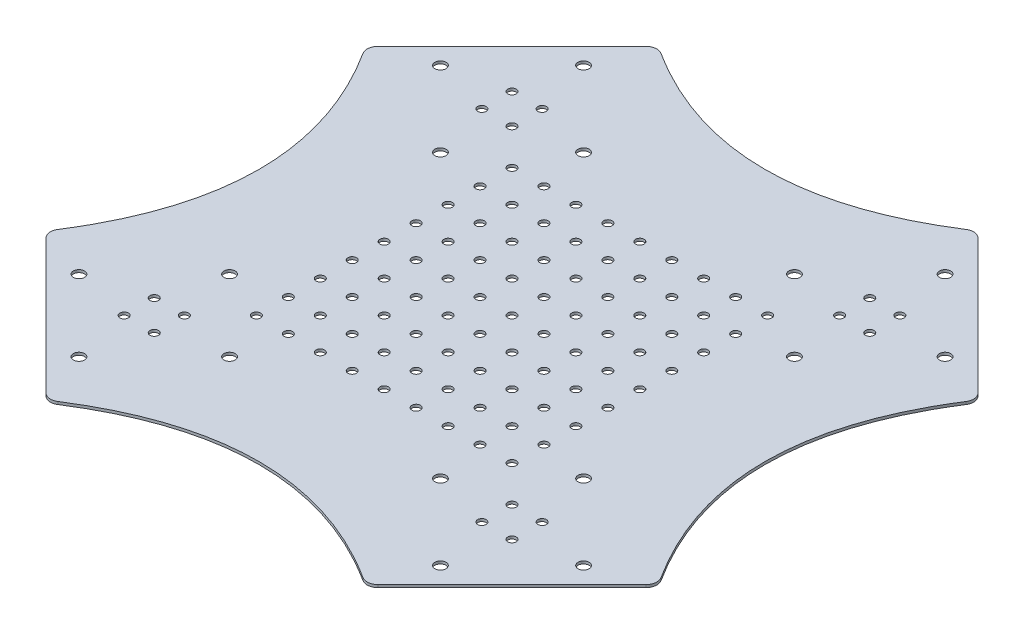
from build123d import *

# Parameters (mm, degrees)
DODANIE_WYCI_GNI_CIE1_DEPTH = 1
ZAOKR_GLENIE1_R             = 4
SZKIC2_R                    = 2.1
WYTNIJ_WYCI_GNI_CIE1_DEPTH  = 162.050129512
SZYK_KO_OWY1_COUNT          = 4
SZKIC3_R                    = 1.6
WYTNIJ_WYCI_GNI_CIE2_DEPTH  = 162.050129512
SZYK_KO_OWY2_OUTLINE_R      = 1.6
SZYK_KO_OWY2_DEPTH          = 1
WYTNIJ_WYCI_GNI_CIE3_REACH  = 163.05
SZKIC4_R                    = 1.6
SZYK_LINIOWY1_COUNT         = 5
SZYK_LINIOWY1_PITCH         = 12
SZYK_LINIOWY1_COUNT_DIR2    = 5
SZYK_LINIOWY1_PITCH_DIR2    = 12
SZYK_KO_OWY3_OUTLINE_R      = 1.6
SZYK_KO_OWY3_DEPTH          = 1


# Read off the part's stored shape, not the designer's step: Szyk kołowy2, Szyk kołowy3
with BuildPart() as part:
    # Szkic1 → Dodanie-wyciągnięcie1 (new body)
    with BuildSketch(Plane(origin=(0, 0, 0), x_dir=(1, 0, 0), z_dir=(0, 1, 0))):
        with BuildLine():
            Line((-60, -115), (-115, -60))
            add(Edge.make_bspline(
                [(-115, 60), (-75, 0), (-115, -60)],
                knots=[0, 0, 0, 1, 1, 1], degree=2))
            Line((-115, 60), (-60, 115))
            add(Edge.make_bspline(
                [(60, 115), (0, 75), (-60, 115)],
                knots=[0, 0, 0, 1, 1, 1], degree=2))
            Line((60, 115), (115, 60))
            add(Edge.make_bspline(
                [(115, -60), (75, 0), (115, 60)],
                knots=[0, 0, 0, 1, 1, 1], degree=2))
            Line((115, -60), (60, -115))
            add(Edge.make_bspline(
                [(-60, -115), (0, -75), (60, -115)],
                knots=[0, 0, 0, 1, 1, 1], degree=2))
        make_face()
    extrude(amount=DODANIE_WYCI_GNI_CIE1_DEPTH)

    # Zaokrąglenie1
    zaokr_glenie1_edges = [part.edges().sort_by_distance(p)[0] for p in [
        (-115, 0.5, -60),
        (-60, 0.5, -115),
        (60, 0.5, -115),
        (115, 0.5, -60),
        (115, 0.5, 60),
        (60, 0.5, 115),
        (-115, 0.5, 60),
        (-60, 0.5, 115),
    ]]
    fillet(zaokr_glenie1_edges, radius=ZAOKR_GLENIE1_R)

    # Szkic2 → Wytnij-wyciągnięcie1 (cut, through all)
    with BuildSketch(Plane(origin=(0, 1, 0), x_dir=(1, 0, 0), z_dir=(0, 1, 0))):
        with Locations(Location((-67.882250994, -94.752308679, 0), (0, 0, 270))):
            Circle(SZKIC2_R)
        with Locations(Location((-94.752308679, -67.882250994, 0), (0, 0, 90))):
            Circle(SZKIC2_R)
        with Locations(Location((-39.597979746, -66.468037432, 0), (0, 0, 90))):
            Circle(SZKIC2_R)
        with Locations(Location((-66.468037432, -39.597979746, 0), (0, 0, 270))):
            Circle(SZKIC2_R)
    wytnij_wyci_gni_cie1 = extrude(amount=-WYTNIJ_WYCI_GNI_CIE1_DEPTH, mode=Mode.SUBTRACT)

    # Szyk kołowy1: Wytnij-wyciągnięcie1 ×4 about axis
    szyk_ko_owy1_axis = Axis((0, 0, 0), (0, 1, 0))
    for i in range(1, SZYK_KO_OWY1_COUNT):
        add(wytnij_wyci_gni_cie1.rotate(szyk_ko_owy1_axis, i * 360 / SZYK_KO_OWY1_COUNT), mode=Mode.SUBTRACT)

    # Szkic3 → Wytnij-wyciągnięcie2 (cut, through all)
    with BuildSketch(Plane(origin=(0, 1, 0), x_dir=(1, 0, 0), z_dir=(0, 1, 0))):
        with Locations(Location((-61.518289963, -61.518289963, 0), (0, 0, 270))):
            Circle(SZKIC3_R)
        with Locations(Location((-61.518289963, 61.518289963, 0), (0, 0, 270))):
            Circle(SZKIC3_R)
        with Locations(Location((61.518289963, 61.518289963, 0), (0, 0, 270))):
            Circle(SZKIC3_R)
        with Locations(Location((61.518289963, -61.518289963, 0), (0, 0, 270))):
            Circle(SZKIC3_R)
        with Locations(Location((-72.831998462, -72.831998462, 0), (0, 0, 270))):
            Circle(SZKIC3_R)
        with Locations(Location((-61.518289963, -72.831998462, 0), (0, 0, 270))):
            Circle(SZKIC3_R)
        with Locations(Location((-72.831998462, -61.518289963, 0), (0, 0, 270))):
            Circle(SZKIC3_R)
    wytnij_wyci_gni_cie2 = extrude(amount=-WYTNIJ_WYCI_GNI_CIE2_DEPTH, mode=Mode.SUBTRACT)

    # Lustro1: Wytnij-wyciągnięcie2 across plane
    add(wytnij_wyci_gni_cie2.mirror(Plane(origin=(0, 0, 0), x_dir=(0, 0, 1), z_dir=(1, 0, 0))), mode=Mode.SUBTRACT)

    # Szyk kołowy2 outline → Szyk kołowy2 (cut)
    with BuildSketch(Plane(origin=(0, 0, 0), x_dir=(1, 0, 0), z_dir=(0, 1, 0))):
        with Locations((-61.518289963, 72.831998462)):
            Circle(SZYK_KO_OWY2_OUTLINE_R)
        with Locations((-72.831998462, 72.831998462)):
            Circle(SZYK_KO_OWY2_OUTLINE_R)
        with Locations((-72.831998462, 61.518289963)):
            Circle(SZYK_KO_OWY2_OUTLINE_R)
        with Locations((61.518289963, 72.831998462)):
            Circle(SZYK_KO_OWY2_OUTLINE_R)
        with Locations((72.831998462, 72.831998462)):
            Circle(SZYK_KO_OWY2_OUTLINE_R)
        with Locations((72.831998462, 61.518289963)):
            Circle(SZYK_KO_OWY2_OUTLINE_R)
    extrude(amount=SZYK_KO_OWY2_DEPTH, mode=Mode.SUBTRACT)

    # Szkic4 → Wytnij-wyciągnięcie3 (cut, up to next)
    with BuildSketch(Plane(origin=(0, 1, 0), x_dir=(1, 0, 0), z_dir=(0, 1, 0)), mode=Mode.PRIVATE) as wytnij_wyci_gni_cie3_sk1:
        with Locations(Location((0, 0, 0), (0, 0, 270))):
            Circle(SZKIC4_R)
    wytnij_wyci_gni_cie3_tool1 = extrude(wytnij_wyci_gni_cie3_sk1.sketch, amount=-WYTNIJ_WYCI_GNI_CIE3_REACH, mode=Mode.PRIVATE) & part.part
    wytnij_wyci_gni_cie3 = wytnij_wyci_gni_cie3_tool1.solids().sort_by_distance((0, 1, 0))[0]
    add(wytnij_wyci_gni_cie3, mode=Mode.SUBTRACT)

    # Szyk liniowy1: Wytnij-wyci_gni_cie3 5 × 5
    with Locations(*[(j * SZYK_LINIOWY1_PITCH_DIR2, 0, i * SZYK_LINIOWY1_PITCH) for i in range(SZYK_LINIOWY1_COUNT) for j in range(SZYK_LINIOWY1_COUNT_DIR2) if (i, j) != (0, 0)]):
        add(wytnij_wyci_gni_cie3, mode=Mode.SUBTRACT)

    # Szyk kołowy3 outline → Szyk kołowy3 (cut)
    with BuildSketch(Plane(origin=(0, 0, 0), x_dir=(1, 0, 0), z_dir=(0, 1, 0))):
        with Locations((36, 48)):
            Circle(SZYK_KO_OWY3_OUTLINE_R)
        with Locations((36, 36)):
            Circle(SZYK_KO_OWY3_OUTLINE_R)
        with Locations((36, 24)):
            Circle(SZYK_KO_OWY3_OUTLINE_R)
        with Locations((48, 12)):
            Circle(SZYK_KO_OWY3_OUTLINE_R)
        with Locations((48, 24)):
            Circle(SZYK_KO_OWY3_OUTLINE_R)
        with Locations((48, 36)):
            Circle(SZYK_KO_OWY3_OUTLINE_R)
        with Locations((48, 48)):
            Circle(SZYK_KO_OWY3_OUTLINE_R)
        with Locations((0, 12)):
            Circle(SZYK_KO_OWY3_OUTLINE_R)
        with Locations((0, 24)):
            Circle(SZYK_KO_OWY3_OUTLINE_R)
        with Locations((0, 36)):
            Circle(SZYK_KO_OWY3_OUTLINE_R)
        with Locations((0, 48)):
            Circle(SZYK_KO_OWY3_OUTLINE_R)
        with Locations((12, 12)):
            Circle(SZYK_KO_OWY3_OUTLINE_R)
        with Locations((12, 24)):
            Circle(SZYK_KO_OWY3_OUTLINE_R)
        with Locations((12, 36)):
            Circle(SZYK_KO_OWY3_OUTLINE_R)
        with Locations((36, 12)):
            Circle(SZYK_KO_OWY3_OUTLINE_R)
        with Locations((24, 48)):
            Circle(SZYK_KO_OWY3_OUTLINE_R)
        with Locations((24, 36)):
            Circle(SZYK_KO_OWY3_OUTLINE_R)
        with Locations((12, 48)):
            Circle(SZYK_KO_OWY3_OUTLINE_R)
        with Locations((24, 12)):
            Circle(SZYK_KO_OWY3_OUTLINE_R)
        with Locations((24, 24)):
            Circle(SZYK_KO_OWY3_OUTLINE_R)
        with Locations((-48, 36)):
            Circle(SZYK_KO_OWY3_OUTLINE_R)
        with Locations((-36, 36)):
            Circle(SZYK_KO_OWY3_OUTLINE_R)
        with Locations((-24, 36)):
            Circle(SZYK_KO_OWY3_OUTLINE_R)
        with Locations((-12, 48)):
            Circle(SZYK_KO_OWY3_OUTLINE_R)
        with Locations((-24, 48)):
            Circle(SZYK_KO_OWY3_OUTLINE_R)
        with Locations((-36, 48)):
            Circle(SZYK_KO_OWY3_OUTLINE_R)
        with Locations((-48, 48)):
            Circle(SZYK_KO_OWY3_OUTLINE_R)
        with Locations((-12, 0)):
            Circle(SZYK_KO_OWY3_OUTLINE_R)
        with Locations((-24, 0)):
            Circle(SZYK_KO_OWY3_OUTLINE_R)
        with Locations((-36, 0)):
            Circle(SZYK_KO_OWY3_OUTLINE_R)
        with Locations((-48, 0)):
            Circle(SZYK_KO_OWY3_OUTLINE_R)
        with Locations((-12, 12)):
            Circle(SZYK_KO_OWY3_OUTLINE_R)
        with Locations((-24, 12)):
            Circle(SZYK_KO_OWY3_OUTLINE_R)
        with Locations((-36, 12)):
            Circle(SZYK_KO_OWY3_OUTLINE_R)
        with Locations((-12, 36)):
            Circle(SZYK_KO_OWY3_OUTLINE_R)
        with Locations((-48, 24)):
            Circle(SZYK_KO_OWY3_OUTLINE_R)
        with Locations((-36, 24)):
            Circle(SZYK_KO_OWY3_OUTLINE_R)
        with Locations((-48, 12)):
            Circle(SZYK_KO_OWY3_OUTLINE_R)
        with Locations((-12, 24)):
            Circle(SZYK_KO_OWY3_OUTLINE_R)
        with Locations((-24, 24)):
            Circle(SZYK_KO_OWY3_OUTLINE_R)
        with Locations((-36, -48)):
            Circle(SZYK_KO_OWY3_OUTLINE_R)
        with Locations((-36, -36)):
            Circle(SZYK_KO_OWY3_OUTLINE_R)
        with Locations((-36, -24)):
            Circle(SZYK_KO_OWY3_OUTLINE_R)
        with Locations((-48, -12)):
            Circle(SZYK_KO_OWY3_OUTLINE_R)
        with Locations((-48, -24)):
            Circle(SZYK_KO_OWY3_OUTLINE_R)
        with Locations((-48, -36)):
            Circle(SZYK_KO_OWY3_OUTLINE_R)
        with Locations((-48, -48)):
            Circle(SZYK_KO_OWY3_OUTLINE_R)
        with Locations((-12, -12)):
            Circle(SZYK_KO_OWY3_OUTLINE_R)
        with Locations((-12, -24)):
            Circle(SZYK_KO_OWY3_OUTLINE_R)
        with Locations((-12, -36)):
            Circle(SZYK_KO_OWY3_OUTLINE_R)
        with Locations((-36, -12)):
            Circle(SZYK_KO_OWY3_OUTLINE_R)
        with Locations((-24, -48)):
            Circle(SZYK_KO_OWY3_OUTLINE_R)
        with Locations((-24, -36)):
            Circle(SZYK_KO_OWY3_OUTLINE_R)
        with Locations((-12, -48)):
            Circle(SZYK_KO_OWY3_OUTLINE_R)
        with Locations((-24, -12)):
            Circle(SZYK_KO_OWY3_OUTLINE_R)
        with Locations((-24, -24)):
            Circle(SZYK_KO_OWY3_OUTLINE_R)
    extrude(amount=SZYK_KO_OWY3_DEPTH, mode=Mode.SUBTRACT)


solid = part.part
